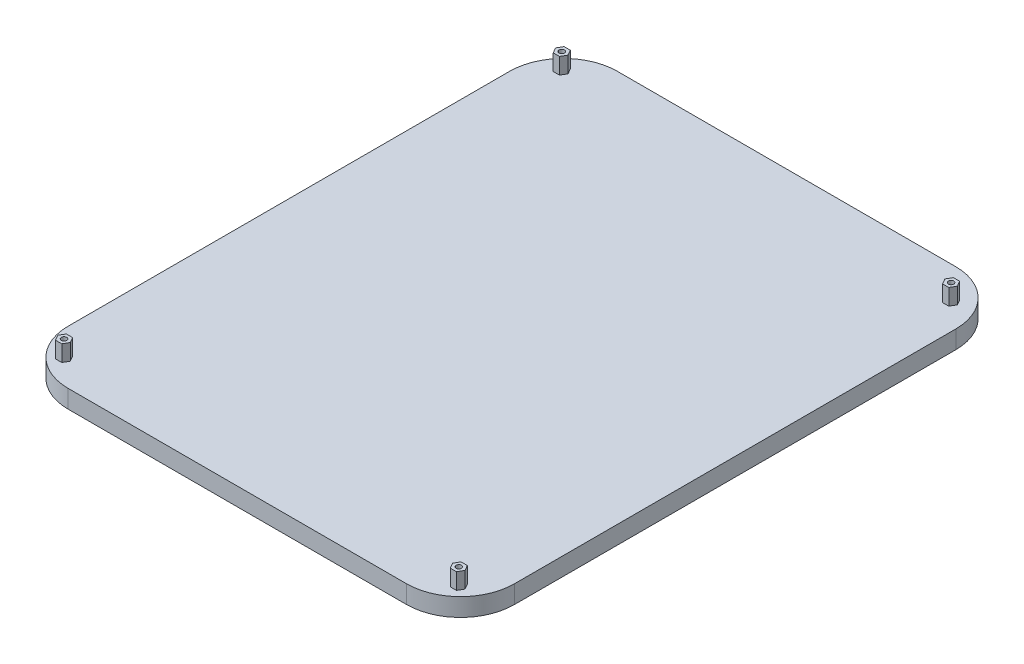
from build123d import *

# Parameters (mm, degrees)
FLOOR_2_DEPTH      = 5
PILLARS_DEPTH      = 4.5
SKETCH4_R          = 0.75
CUT_EXTRUDE2_DEPTH = 5
SKETCH5_R          = 0.75
CUT_EXTRUDE3_DEPTH = 5
SKETCH6_R          = 0.75
CUT_EXTRUDE4_DEPTH = 5
SKETCH3_R          = 0.75
CUT_EXTRUDE1_DEPTH = 5


with BuildPart() as part:
    # Sketch1 → Floor 2 (new body)
    with BuildSketch(Plane(origin=(0, 0, 0), x_dir=(1, 0, 0), z_dir=(0, 1, 0))):
        with BuildLine():
            Line((-46.9525, -76.2), (46.9525, -76.2))
            ThreePointArc((46.9525, -76.2), (57.530817447, -71.818317447), (61.9125, -61.24))
            Line((61.9125, -61.24), (61.9125, 61.24))
            ThreePointArc((61.9125, 61.24), (57.530817447, 71.818317447), (46.9525, 76.2))
            Line((46.9525, 76.2), (-46.9525, 76.2))
            ThreePointArc((-46.9525, 76.2), (-57.530817447, 71.818317447), (-61.9125, 61.24))
            Line((-61.9125, 61.24), (-61.9125, -61.24))
            ThreePointArc((-61.9125, -61.24), (-57.530817447, -71.818317447), (-46.9525, -76.2))
        make_face()
    extrude(amount=FLOOR_2_DEPTH)

    # Sketch2 → Pillars (add)
    with BuildSketch(Plane(origin=(0, 5, 0), x_dir=(1, 0, 0), z_dir=(0, 1, 0))):
        Polygon((53.743474596, -70.874), (55.475525404, -70.874), (56.341550808, -69.374), (55.475525404, -67.874), (53.743474596, -67.874), (52.877449192, -69.374), align=None)
        Polygon((55.475525404, 68.739), (53.743474596, 68.739), (52.877449192, 67.239), (53.743474596, 65.739), (55.475525404, 65.739), (56.341550808, 67.239), align=None)
        Polygon((-54.061474596, 67.239), (-53.195449192, 68.739), (-54.061474596, 70.239), (-55.793525404, 70.239), (-56.659550808, 68.739), (-55.793525404, 67.239), align=None)
        Polygon((-53.195449192, -69.374), (-54.061474596, -67.874), (-55.793525404, -67.874), (-56.659550808, -69.374), (-55.793525404, -70.874), (-54.061474596, -70.874), align=None)
    extrude(amount=PILLARS_DEPTH)

    # Sketch4 → Cut-Extrude2 (cut)
    with BuildSketch(Plane(origin=(0, 9.5, 0), x_dir=(1, 0, 0), z_dir=(0, 1, 0))):
        with Locations((54.60715077, 67.232352791)):
            Circle(SKETCH4_R)
    extrude(amount=-CUT_EXTRUDE2_DEPTH, mode=Mode.SUBTRACT)

    # Sketch5 → Cut-Extrude3 (cut)
    with BuildSketch(Plane(origin=(0, 9.5, 0), x_dir=(1, 0, 0), z_dir=(0, 1, 0))):
        with Locations((-54.9275, -69.374)):
            Circle(SKETCH5_R)
    extrude(amount=-CUT_EXTRUDE3_DEPTH, mode=Mode.SUBTRACT)

    # Sketch6 → Cut-Extrude4 (cut)
    with BuildSketch(Plane(origin=(0, 9.5, 0), x_dir=(1, 0, 0), z_dir=(0, 1, 0))):
        with Locations((-54.9275, 68.739)):
            Circle(SKETCH6_R)
    extrude(amount=-CUT_EXTRUDE4_DEPTH, mode=Mode.SUBTRACT)

    # Sketch3 → Cut-Extrude1 (cut)
    with BuildSketch(Plane(origin=(0, 9.5, 0), x_dir=(1, 0, 0), z_dir=(0, 1, 0))):
        with Locations((54.6095, -69.374)):
            Circle(SKETCH3_R)
    extrude(amount=-CUT_EXTRUDE1_DEPTH, mode=Mode.SUBTRACT)


solid = part.part
